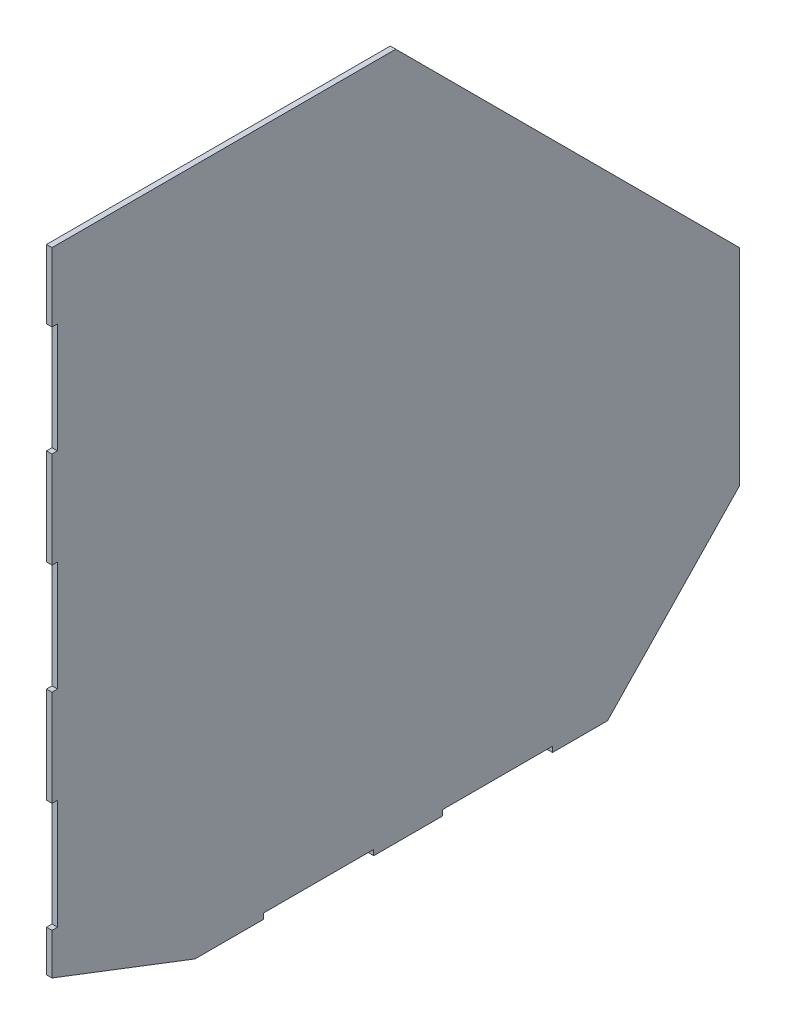
from build123d import *

# Parameters (mm, degrees)
BOSS_EXTRUDE1_DEPTH = 2


with BuildPart() as part:
    # Sketch1 → Boss-Extrude1 (new body)
    with BuildSketch(Plane(origin=(0, 0, 0), x_dir=(0, 0, -1), z_dir=(1, 0, 0))):
        Polygon((0, 250), (125, 250), (250, 125), (250, 50), (202, 0), (182, 0), (182, 2), (142, 2), (142, 0), (117, 0), (117, 2), (77, 2), (77, 0), (52, 0), (0, 20), (0, 35), (2, 35), (2, 75), (0, 75), (0, 110), (2, 110), (2, 150), (0, 150), (0, 185), (2, 185), (2, 225), (0, 225), align=None)
    extrude(amount=BOSS_EXTRUDE1_DEPTH)


solid = part.part
